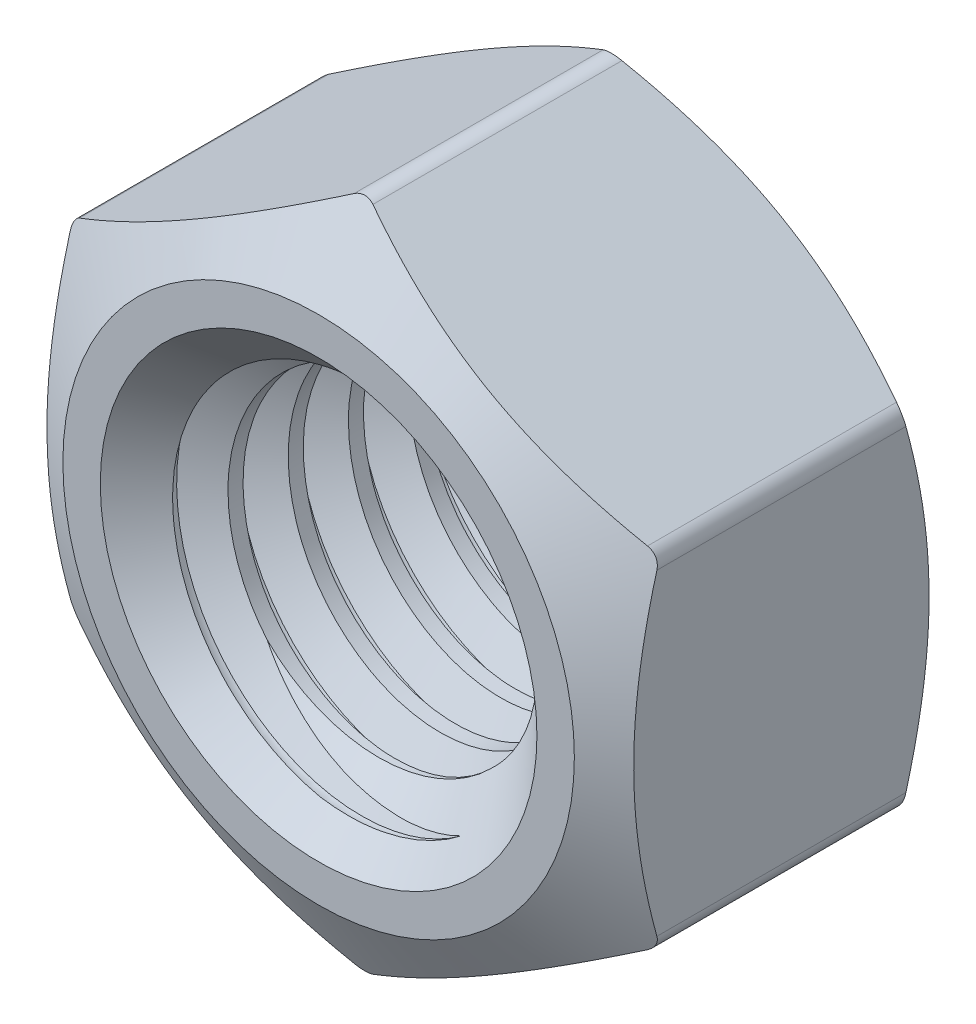
from build123d import *

# Parameters (mm, degrees)
SKETCH1_R               = 2.1
BOSS_EXTRUDE1_DEPTH     = 4.5
CHAMFER1_SIZE           = 0.8
CUT_SWEEP8_PITCH        = 0.8
SKETCH4_OUTSIDE_W       = 74.694
SKETCH4_OUTSIDE_H       = 75.9
SKETCH4_OUTSIDE_R       = 3.397114317
CUT_EXTRUDE2_DEPTH      = 18
CUT_EXTRUDE2_DRAFT      = -60
MIRROR1_COPY_1_SKETCH_W = 74.694
MIRROR1_COPY_1_SKETCH_H = 75.9
MIRROR1_COPY_1_SKETCH_R = 3.397114317
MIRROR1_COPY_1_DEPTH    = 18
MIRROR1_COPY_1_DRAFT    = -60
FILLET1_R               = 0.25


with BuildPart() as part:
    # Sketch1 → Boss-Extrude1 (new body)
    with BuildSketch(Plane.XY):
        Polygon((0, 4.5), (-3.897114317, 2.25), (-3.897114317, -2.25), (0, -4.5), (3.897114317, -2.25), (3.897114317, 2.25), align=None)
        Circle(SKETCH1_R, mode=Mode.SUBTRACT)
    extrude(amount=BOSS_EXTRUDE1_DEPTH)

    # Chamfer1
    chamfer1_edges = [part.edges().sort_by_distance(p)[0] for p in [
        (-2.1, 0, 0),
        (-2.1, 0, 4.5),
    ]]
    chamfer(chamfer1_edges, length=CHAMFER1_SIZE)

    # Cut-Sweep8: the profile of Sketch3 screwed along a right-hand helix of 5.625 turns, 8 arcs to a turn; built about Z, then put on its axis
    cut_sweep8_z = Axis((0, 0, 0), (0, 0, 1))
    cut_sweep8_corners = [(2.533012702, 0, -0.25), (2.1, 0, 0), (1.926794919, 0, 0), (1.926794919, 0, -0.6), (2.1, 0, -0.6), (2.533012702, 0, -0.35)]
    with BuildLine(mode=Mode.PRIVATE) as cut_sweep8_profile:
        Line(cut_sweep8_corners[0], cut_sweep8_corners[1])
        Line(cut_sweep8_corners[1], cut_sweep8_corners[2])
        Line(cut_sweep8_corners[2], cut_sweep8_corners[3])
        Line(cut_sweep8_corners[3], cut_sweep8_corners[4])
        Line(cut_sweep8_corners[4], cut_sweep8_corners[5])
        ThreePointArc((2.533012702, 0, -0.35), (2.537780212, 0, -0.3), (2.533012702, 0, -0.25))
    cut_sweep8_cap = Face(cut_sweep8_profile.wire())
    cut_sweep8_arcs = [((2.533012702, 0, -0.35), (2.542635206, 0, -0.3), (2.533012702, 0, -0.25), (1, 0.9819805060619667, 1))]  # start, shoulder, end, weights
    cut_sweep8_turn_angles = [0, 22.5, 45, 67.5, 90, 112.5, 135, 157.5, 180, 202.5, 225, 247.5, 270, 292.5, 315, 337.5, 360]
    cut_sweep8_turn_weights = [1, 0.9238795325112867, 1, 0.9238795325112867, 1, 0.9238795325112867, 1, 0.9238795325112867, 1, 0.9238795325112867, 1, 0.9238795325112867, 1, 0.9238795325112867, 1, 0.9238795325112867, 1]
    cut_sweep8_turn_rails = [Edge.make_bspline([Vector(p[0], p[1], 0).rotate(cut_sweep8_z, cut_sweep8_turn_angles[k]) / cut_sweep8_turn_weights[k] + Vector(0, 0, p[2] + CUT_SWEEP8_PITCH * cut_sweep8_turn_angles[k] / 360) for k in range(17)], [0, 0, 0, 1, 1, 2, 2, 3, 3, 4, 4, 5, 5, 6, 6, 7, 7, 8, 8, 8], 2, cut_sweep8_turn_weights) for p in cut_sweep8_corners]
    cut_sweep8_turn_sides = [*[Face.make_surface_from_curves(cut_sweep8_turn_rails[p[0]], cut_sweep8_turn_rails[p[1]]) for p in [(0, 1), (1, 2), (2, 3), (3, 4), (4, 5)]], *[Face.make_bezier_surface([[Vector(p[j][0], p[j][1], 0).rotate(cut_sweep8_z, cut_sweep8_turn_angles[2 * i + k]) / cut_sweep8_turn_weights[2 * i + k] + Vector(0, 0, p[j][2] + CUT_SWEEP8_PITCH * cut_sweep8_turn_angles[2 * i + k] / 360) for k in range(3)] for j in range(3)], [[p[3][j] * cut_sweep8_turn_weights[2 * i + k] for k in range(3)] for j in range(3)]) for p in cut_sweep8_arcs for i in range(8)]]
    cut_sweep8_last_angles = [1800, 1822.5, 1845, 1867.5, 1890, 1912.5, 1935, 1957.5, 1980, 2002.5, 2025]
    cut_sweep8_last_weights = [1, 0.9238795325112867, 1, 0.9238795325112867, 1, 0.9238795325112867, 1, 0.9238795325112867, 1, 0.9238795325112685, 1]
    cut_sweep8_last_rails = [Edge.make_bspline([Vector(p[0], p[1], 0).rotate(cut_sweep8_z, cut_sweep8_last_angles[k]) / cut_sweep8_last_weights[k] + Vector(0, 0, p[2] + CUT_SWEEP8_PITCH * cut_sweep8_last_angles[k] / 360) for k in range(11)], [0, 0, 0, 1, 1, 2, 2, 3, 3, 4, 4, 5, 5, 5], 2, cut_sweep8_last_weights) for p in cut_sweep8_corners]
    cut_sweep8_last_sides = [*[Face.make_surface_from_curves(cut_sweep8_last_rails[p[0]], cut_sweep8_last_rails[p[1]]) for p in [(0, 1), (1, 2), (2, 3), (3, 4), (4, 5)]], *[Face.make_bezier_surface([[Vector(p[j][0], p[j][1], 0).rotate(cut_sweep8_z, cut_sweep8_last_angles[2 * i + k]) / cut_sweep8_last_weights[2 * i + k] + Vector(0, 0, p[j][2] + CUT_SWEEP8_PITCH * cut_sweep8_last_angles[2 * i + k] / 360) for k in range(3)] for j in range(3)], [[p[3][j] * cut_sweep8_last_weights[2 * i + k] for k in range(3)] for j in range(3)]) for p in cut_sweep8_arcs for i in range(5)]]
    cut_sweep8 = Plane(origin=(0, 0, 0), x_dir=(0, 1, 0), z_dir=(0, 0, 1)) * Solid(Shell([*[p.moved(Location((0, 0, CUT_SWEEP8_PITCH * i))) for i in range(5) for p in cut_sweep8_turn_sides], *cut_sweep8_last_sides, cut_sweep8_cap, cut_sweep8_cap.rotate(cut_sweep8_z, 2025).moved(Location((0, 0, CUT_SWEEP8_PITCH * 2025 / 360)))]))
    add(cut_sweep8, mode=Mode.SUBTRACT)


with BuildPart() as cut_extrude2_tool:
    # Sketch4 outside → Cut-Extrude2 (with draft: the straight prism first)
    with BuildSketch(Plane(origin=(0, 0, 0), x_dir=(-1, 0, 0), z_dir=(0, 0, -1))):
        Rectangle(SKETCH4_OUTSIDE_W, SKETCH4_OUTSIDE_H)
        Circle(SKETCH4_OUTSIDE_R, mode=Mode.SUBTRACT)
    extrude(amount=-CUT_EXTRUDE2_DEPTH)
    # Cut-Extrude2: the draft: its side faces are tilted about the plane it starts from
    cut_extrude2_sides = [cut_extrude2_tool.faces().sort_by_distance(p)[0] for p in [
        (0, -37.95, 9),
        (-37.347, 0, 9),
        (0, 37.95, 9),
        (37.347, 0, 9),
        (3.397114317, 0, 9),
    ]]
    draft(cut_extrude2_sides, Plane(origin=(0, 0, 0), x_dir=(-1, 0, 0), z_dir=(0, 0, -1)), CUT_EXTRUDE2_DRAFT)


with BuildPart() as part_1:
    add(part.part)

    # Cut-Extrude2: cut by cut_extrude2_tool
    add(cut_extrude2_tool.part, mode=Mode.SUBTRACT)


with BuildPart() as mirror1_copy_1_tool:
    # Mirror1 copy 1 sketch → Mirror1 copy 1 (with draft: the straight prism first)
    with BuildSketch(Plane(origin=(0, 0, 4.5), x_dir=(-1, 0, 0), z_dir=(0, 0, 1))):
        Rectangle(MIRROR1_COPY_1_SKETCH_W, MIRROR1_COPY_1_SKETCH_H)
        Circle(MIRROR1_COPY_1_SKETCH_R, mode=Mode.SUBTRACT)
    extrude(amount=-MIRROR1_COPY_1_DEPTH)
    # Mirror1 copy 1: the draft: its side faces are tilted about the plane it starts from
    mirror1_copy_1_sides = [mirror1_copy_1_tool.faces().sort_by_distance(p)[0] for p in [
        (0, -37.95, -4.5),
        (-37.347, 0, -4.5),
        (0, 37.95, -4.5),
        (37.347, 0, -4.5),
        (3.397114317, 0, -4.5),
    ]]
    draft(mirror1_copy_1_sides, Plane(origin=(0, 0, 4.5), x_dir=(-1, 0, 0), z_dir=(0, 0, 1)), MIRROR1_COPY_1_DRAFT)


with BuildPart() as part_2:
    add(part_1.part)

    # Mirror1 copy 1: cut by mirror1_copy_1_tool
    add(mirror1_copy_1_tool.part, mode=Mode.SUBTRACT)

    # Fillet1
    fillet1_edges = [part_2.edges().sort_by_distance(p)[0] for p in [
        (0, -4.5, 2.25),
        (-3.897114317, -2.25, 2.25),
        (-3.897114317, 2.25, 2.25),
        (3.897114317, -2.25, 2.25),
        (3.897114317, 2.25, 2.25),
        (0, 4.5, 2.25),
    ]]
    fillet(fillet1_edges, radius=FILLET1_R)


solid = part_2.part
